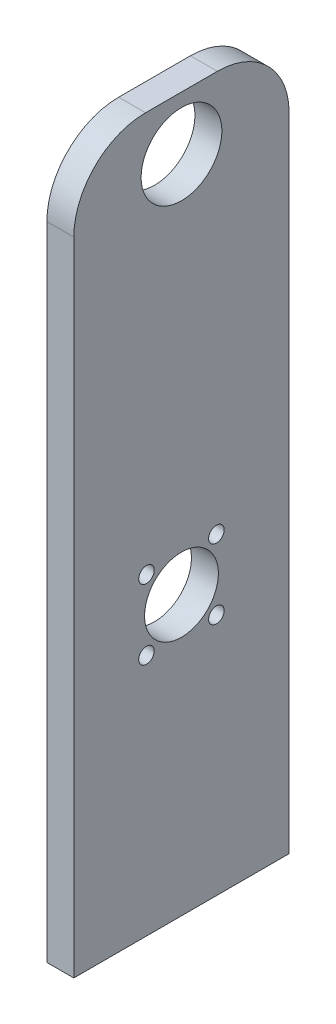
from build123d import *

# Parameters (mm, degrees)
SKETCH1_W           = 9.525
SKETCH1_H           = 76.2
BOSS_EXTRUDE1_DEPTH = 126.238
SKETCH3_R           = 14.2875
SKETCH3_R_2         = 2.75
SKETCH3_R_3         = 13.0556
CUT_EXTRUDE2_DEPTH  = 45.974
FILLET1_R           = 25.4


with BuildPart() as part:
    # Sketch1 → Boss-Extrude1 (new, symmetric)
    with BuildSketch(Plane(origin=(0, 0, 0), x_dir=(1, 0, 0), z_dir=(0, 1, 0))):
        Rectangle(SKETCH1_W, SKETCH1_H)
    extrude(amount=BOSS_EXTRUDE1_DEPTH, both=True)

    # Sketch3 → Cut-Extrude2 (cut)
    with BuildSketch(Plane.ZY.offset(4.7625)):
        with Locations((0, 107.188)):
            Circle(SKETCH3_R)
        with Locations((-12.365845519, -15.443650505)):
            Circle(SKETCH3_R_2)
        with Locations((12.374792935, -15.443650505)):
            Circle(SKETCH3_R_2)
        with Locations((-12.365845519, -40.187792935)):
            Circle(SKETCH3_R_2)
        with Locations((12.374792935, -40.187792935)):
            Circle(SKETCH3_R_2)
        with Locations((0, -27.813)):
            Circle(SKETCH3_R_3)
    extrude(amount=-CUT_EXTRUDE2_DEPTH, mode=Mode.SUBTRACT)

    # Fillet1
    fillet1_edges = [part.edges().sort_by_distance(p)[0] for p in [
        (0, 126.238, 38.1),
        (0, 126.238, -38.1),
    ]]
    fillet(fillet1_edges, radius=FILLET1_R)


solid = part.part
